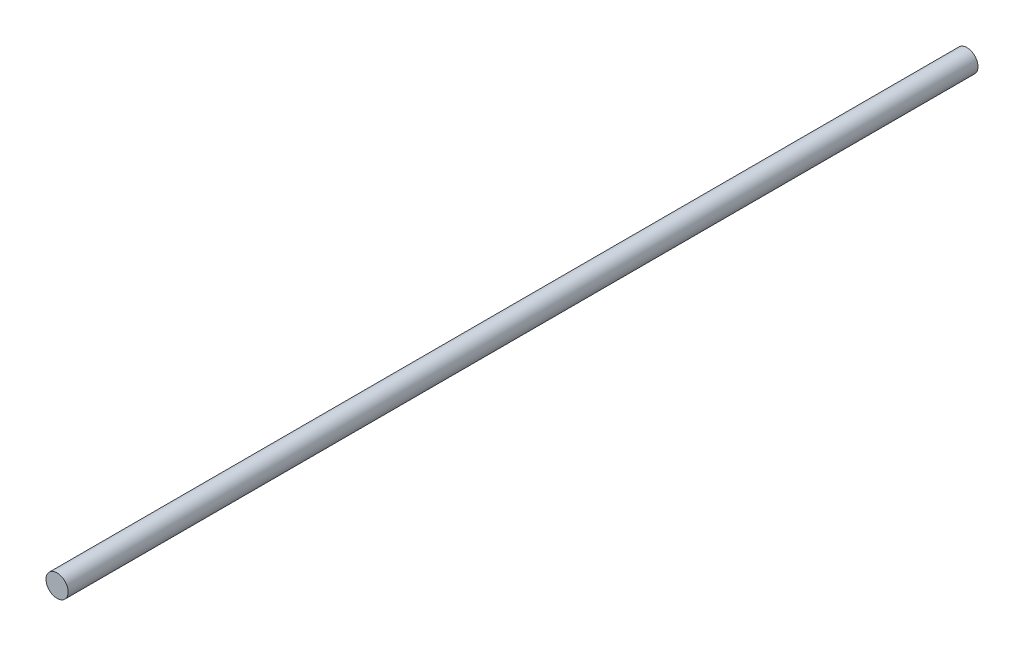
from build123d import *

# Parameters (mm, degrees)
SKETCH1_R           = 6
BOSS_EXTRUDE1_DEPTH = 247


with BuildPart() as part:
    # Sketch1 → Boss-Extrude1 (new, symmetric)
    with BuildSketch(Plane.XY):
        Circle(SKETCH1_R)
    extrude(amount=BOSS_EXTRUDE1_DEPTH, both=True)


solid = part.part
